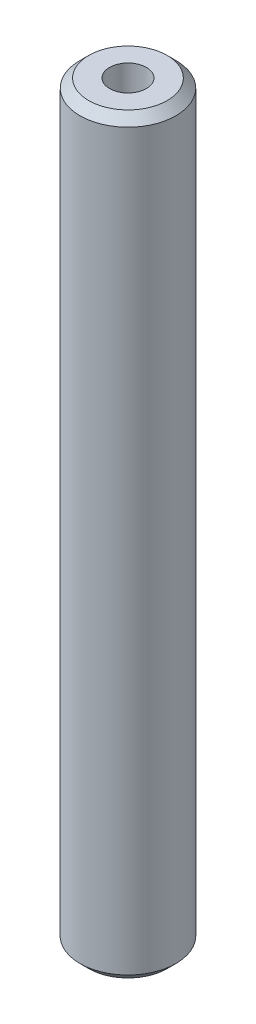
from build123d import *

# Parameters (mm, degrees)
SKETCH1_R           = 30
BOSS_EXTRUDE1_DEPTH = 470.389015523
SKETCH2_R           = 11.513113185
CUT_EXTRUDE1_DEPTH  = 473.298450056
CHAMFER1_SIZE       = 5.483733301


with BuildPart() as part:
    # Sketch1 → Boss-Extrude1 (new body)
    with BuildSketch(Plane(origin=(0, 0, 0), x_dir=(1, 0, 0), z_dir=(0, 1, 0))):
        Circle(SKETCH1_R)
    extrude(amount=BOSS_EXTRUDE1_DEPTH)

    # Sketch2 → Cut-Extrude1 (cut, through all)
    with BuildSketch(Plane(origin=(0, 0, 0), x_dir=(1, 0, 0), z_dir=(0, 1, 0))):
        Circle(SKETCH2_R)
    extrude(amount=CUT_EXTRUDE1_DEPTH, mode=Mode.SUBTRACT)

    # Chamfer1
    chamfer1_edges = [part.edges().sort_by_distance(p)[0] for p in [
        (-30, 470.389015523, 0),
        (-30, 0, 0),
    ]]
    chamfer(chamfer1_edges, length=CHAMFER1_SIZE)


solid = part.part
